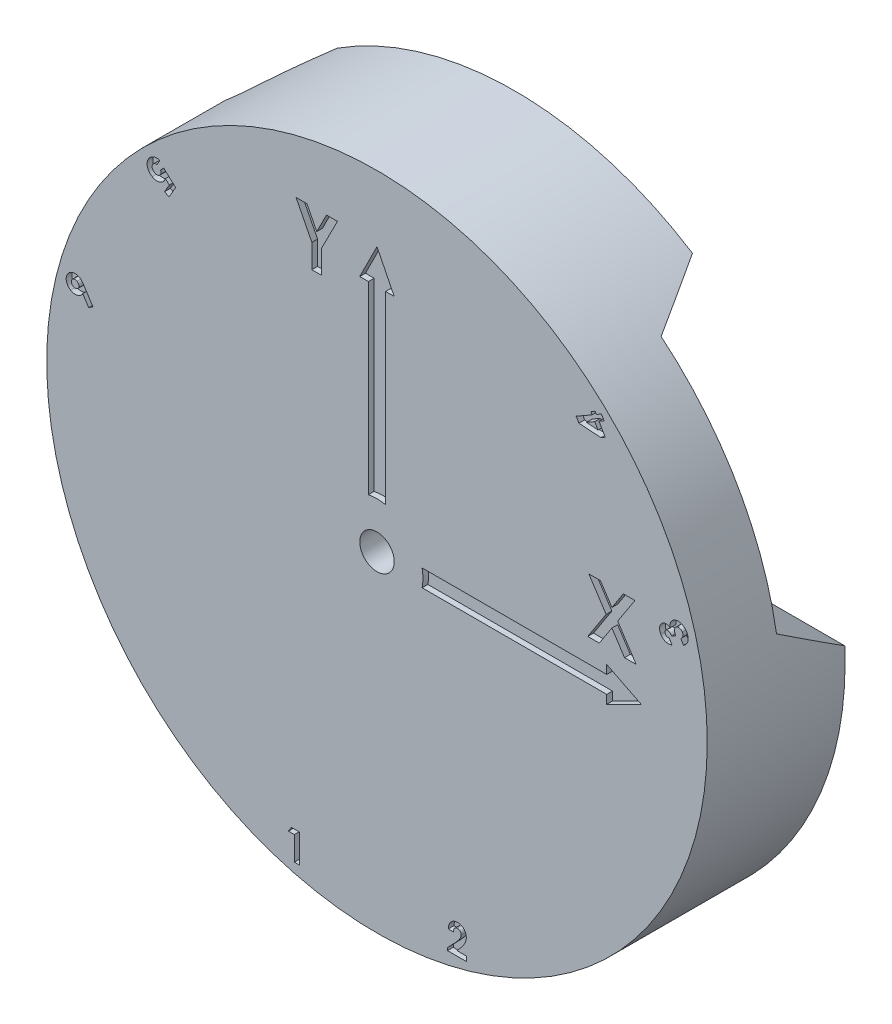
from build123d import *

# Parameters (mm, degrees)
ESQUISSE2_R                          = 57.5
BOSS_EXTRU_1_DEPTH                   = 12
ENL_V_MAT_EXTRU_12_DEPTH             = 1
ENL_V_MAT_EXTRU_13_DEPTH             = 1
ENL_V_MAT_EXTRU_16_DEPTH             = 1
ESQUISSE12_R                         = 3
ENL_V_MAT_EXTRU_14_DEPTH             = 83.197931987
ESQUISSE17_R                         = 57.5
ESQUISSE17_R_2                       = 40
BOSS_EXTRU_2_DEPTH                   = 12
EMPREINTE1_START                     = -29.216029699
EMPREINTE1_OUTLINE_R                 = 2
EMPREINTE1_DEPTH                     = 12.7
EMPREINTE1_2_OUTLINE_R               = 2
EMPREINTE1_2_DEPTH                   = 12.7
EMPREINTE1_START_2                   = 16.516029699
EMPREINTE1_3_OUTLINE_R               = 2
EMPREINTE1_3_DEPTH                   = 12.7
ENL_V_MAT_EXTRU_15_REACH             = 150.293
ENL_V_MAT_EXTRU_15_DIRECTION_2_REACH = 150.293
R_P_TITION_CIRCULAIRE1_COUNT         = 3
R_P_TITION_CIRCULAIRE1_COPY_1_REACH  = 150.293
R_P_TITION_CIRCULAIRE1_COPY_2_REACH  = 150.293
R_P_TITION_CIRCULAIRE1_COPY_3_REACH  = 150.293
R_P_TITION_CIRCULAIRE1_COPY_4_REACH  = 150.293
ENL_V_MAT_EXTRU_17_DEPTH             = 5


# Read off the part's stored shape, not the designer's step: Empreinte1
with BuildPart() as part:
    # Esquisse2 → Boss.-Extru.1 (new body)
    with BuildSketch(Plane.XY.offset(86)):
        Circle(ESQUISSE2_R)
    extrude(amount=-BOSS_EXTRU_1_DEPTH)

    # Esquisse16 → Enlèv. mat.-Extru.12 (cut)
    # profile 1 of 6: a face of its own
    with BuildSketch(Plane.XY.offset(86)):
        with BuildLine():
            Line((13.307692308, -50.666666667), (12.41025641, -50.666666667))
            add(Edge.make_bspline(
                [(12.41025641, -50.666666667), (12.414132298, -50.598780389), (12.421705551, -50.466134678), (12.451830035, -50.273462535), (12.49219581, -50.091408548), (12.546069295, -49.92060956), (12.613764854, -49.761127634), (12.693540506, -49.612419089), (12.787434338, -49.475266877), (12.893447979, -49.350332424), (13.009781611, -49.238252573), (13.134020032, -49.138875536), (13.268063636, -49.056872107), (13.409463338, -48.989390876), (13.55819506, -48.935476508), (13.715666038, -48.899430391), (13.880512802, -48.875019607), (13.99336376, -48.872883565), (14.05088141, -48.871794872)],
                knots=[0, 0, 0, 0, 1.199038563, 2.342849363, 3.436047546, 4.486744587, 5.497670872, 6.488682221, 7.459191391, 8.424610317, 9.374430501, 10.305433194, 11.225809216, 12.140057399, 13.06607119, 14.010487599, 14.985989317, 16, 16, 16, 16], degree=3))
            add(Edge.make_bspline(
                [(14.05088141, -48.871794872), (14.12148351, -48.873997843), (14.259315353, -48.87829856), (14.459595954, -48.914985102), (14.646636137, -48.976349014), (14.820299942, -49.06209058), (14.979108939, -49.171016253), (15.123036791, -49.300892291), (15.247730892, -49.454443561), (15.353981839, -49.625281047), (15.442263677, -49.8061739), (15.504127912, -49.993224611), (15.544790608, -50.181469614), (15.549127536, -50.308224271), (15.551282051, -50.37119391)],
                knots=[0, 0, 0, 0, 1.075374347, 2.099382735, 3.09057751, 4.06680945, 5.040638231, 6.016817125, 7.011024321, 8.044445721, 9.0776792, 10.070479129, 11.0414456, 12, 12, 12, 12], degree=3))
            add(Edge.make_bspline(
                [(15.551282051, -50.37119391), (15.550443197, -50.409282399), (15.54875479, -50.485945118), (15.537015075, -50.601954627), (15.519403182, -50.720123876), (15.49284874, -50.840351545), (15.459733173, -50.962671335), (15.419559204, -51.087449309), (15.371394959, -51.21397802), (15.3160442, -51.343681527), (15.250010604, -51.476980927), (15.17312366, -51.61587443), (15.083342615, -51.760238827), (14.98175191, -51.910889245), (14.867858143, -52.067588086), (14.741105323, -52.229863324), (14.602953345, -52.398286765), (14.504903, -52.510868383), (14.454527244, -52.568709936)],
                knots=[0, 0, 0, 0, 0.728284026, 1.46585585, 2.227944881, 3.01186502, 3.81876927, 4.650621989, 5.517437689, 6.406905708, 7.346299482, 8.360816762, 9.441613733, 10.596154504, 11.834900912, 13.145207542, 14.533280747, 16, 16, 16, 16], degree=3))
            Line((14.454527244, -52.568709936), (13.932692308, -53.166666667))
            Line((13.932692308, -53.166666667), (15.615384615, -53.166666667))
            Line((15.615384615, -53.166666667), (15.615384615, -54))
            Line((15.615384615, -54), (12.282051282, -54))
            Line((12.282051282, -54), (12.282051282, -53.545272436))
            Line((12.282051282, -53.545272436), (13.762419872, -51.969751603))
            add(Edge.make_bspline(
                [(13.762419872, -51.969751603), (13.805280347, -51.923793171), (13.888288376, -51.834785317), (14.006400247, -51.704067815), (14.113281058, -51.580020026), (14.206714546, -51.46132109), (14.291603982, -51.35182112), (14.364164152, -51.248219648), (14.425058925, -51.151453269), (14.491168838, -51.034769916), (14.553951524, -50.895604255), (14.611558438, -50.735279706), (14.646673838, -50.582046362), (14.651520874, -50.48219622), (14.653846154, -50.434294872)],
                knots=[0, 0, 0, 0, 1.246127091, 2.413378631, 3.493388633, 4.492180848, 5.408488754, 6.240484944, 6.999099869, 7.674939598, 8.898438119, 10.020720584, 11.050475521, 12, 12, 12, 12], degree=3))
            add(Edge.make_bspline(
                [(14.653846154, -50.434294872), (14.652107598, -50.387954013), (14.648738868, -50.298161168), (14.611719249, -50.170431325), (14.554367171, -50.054784991), (14.473549993, -49.954677809), (14.37565508, -49.872413099), (14.262528312, -49.811226919), (14.135092005, -49.775922774), (14.045756726, -49.771503956), (13.999799679, -49.769230769)],
                knots=[0, 0, 0, 0, 1.062038974, 2.057870785, 3.028805853, 4.01125022, 4.991535629, 5.949134679, 6.94496649, 8, 8, 8, 8], degree=3))
            add(Edge.make_bspline(
                [(13.999799679, -49.769230769), (13.976057684, -49.770070512), (13.929317753, -49.77172368), (13.860613707, -49.782728373), (13.795236872, -49.802122995), (13.732459566, -49.82810906), (13.672951766, -49.862553775), (13.616863568, -49.905012374), (13.563604014, -49.954405887), (13.513417373, -50.010579868), (13.467740978, -50.073270047), (13.427171371, -50.141903878), (13.393627059, -50.216438757), (13.364093428, -50.295890711), (13.341315679, -50.381113118), (13.324730652, -50.471595932), (13.312122163, -50.567191948), (13.309195788, -50.63290522), (13.307692308, -50.666666667)],
                knots=[0, 0, 0, 0, 0.903469896, 1.778625579, 2.63899355, 3.493148037, 4.358286772, 5.247621495, 6.164656832, 7.118446693, 8.109501108, 9.111810964, 10.146451449, 11.215617525, 12.33435995, 13.498009769, 14.714554818, 16, 16, 16, 16], degree=3))
        make_face()
    # profile 2 of 6: a face of its own
    with BuildSketch(Plane.XY.offset(86)):
        Polygon((-14.887219551, -49), (-13.5, -49), (-13.5, -54), (-14.397435897, -54), (-14.397435897, -49.833333333), (-15.423076923, -49.833333333), align=None)
    # profile 3 of 6: a face of its own
    with BuildSketch(Plane.XY.offset(86)):
        with BuildLine():
            Line((50.886165074, 12.41342527), (51.33788783, 11.630172065))
            add(Edge.make_bspline(
                [(51.33788783, 11.630172065), (51.296037285, 11.613554286), (51.213635119, 11.580834498), (51.088741816, 11.542842953), (50.965391179, 11.515946784), (50.844348324, 11.49700853), (50.724654303, 11.490720787), (50.607056527, 11.491970532), (50.491294494, 11.504915023), (50.415954719, 11.521656249), (50.378352574, 11.530011809)],
                knots=[0, 0, 0, 0, 1.100637514, 2.16711431, 3.187091716, 4.185678312, 5.158749046, 6.113954241, 7.058672956, 8, 8, 8, 8], degree=3))
            add(Edge.make_bspline(
                [(50.378352574, 11.530011809), (50.327224682, 11.544247327), (50.226169977, 11.572383947), (50.082606962, 11.633748016), (49.947150912, 11.706654345), (49.821662302, 11.794977525), (49.70345368, 11.89484315), (49.59659863, 12.010675414), (49.495925861, 12.137552335), (49.439505991, 12.231445763), (49.410804497, 12.279210527)],
                knots=[0, 0, 0, 0, 1.010869218, 1.99799147, 2.969307492, 3.938723657, 4.918429718, 5.913645952, 6.938645537, 8, 8, 8, 8], degree=3))
            add(Edge.make_bspline(
                [(49.410804497, 12.279210527), (49.387050874, 12.322919342), (49.34043012, 12.408705749), (49.283676364, 12.541889011), (49.241932626, 12.676271674), (49.212261177, 12.810912563), (49.197026334, 12.946534051), (49.196355859, 13.082763818), (49.208468189, 13.219911876), (49.233475925, 13.355980708), (49.269854279, 13.488262984), (49.318257976, 13.612873545), (49.376169188, 13.729121523), (49.445892103, 13.835308181), (49.52455183, 13.933755781), (49.613774595, 14.022888542), (49.713963319, 14.103132462), (49.787227489, 14.148286686), (49.824466356, 14.17123777)],
                knots=[0, 0, 0, 0, 1.10807358, 2.174793583, 3.219495373, 4.239455406, 5.242563574, 6.254351592, 7.270043138, 8.306073729, 9.333090522, 10.322281198, 11.280465358, 12.221397179, 13.147387919, 14.083750151, 15.026004476, 16, 16, 16, 16], degree=3))
            add(Edge.make_bspline(
                [(49.824466356, 14.17123777), (49.872210612, 14.19643303), (49.966529003, 14.246206061), (50.118871729, 14.29442127), (50.275927768, 14.318094963), (50.436872784, 14.320599189), (50.599635818, 14.297671583), (50.762646307, 14.252796614), (50.923280183, 14.17999996), (51.025074145, 14.116687533), (51.077471163, 14.084098347)],
                knots=[0, 0, 0, 0, 0.974570112, 1.925255358, 2.872042329, 3.837937071, 4.824805201, 5.833908719, 6.885034805, 8, 8, 8, 8], degree=3))
            add(Edge.make_bspline(
                [(51.077471163, 14.084098347), (51.069158003, 14.121714127), (51.052779495, 14.195824375), (51.039504703, 14.307130251), (51.032618862, 14.416234732), (51.036514899, 14.522991939), (51.045373241, 14.628072044), (51.066273483, 14.730403236), (51.094224849, 14.830891382), (51.130146714, 14.928800163), (51.173948034, 15.023234991), (51.226938472, 15.112154445), (51.284234916, 15.198063823), (51.351188341, 15.277143623), (51.424465337, 15.351544373), (51.505048861, 15.421067125), (51.593090157, 15.484989402), (51.655788444, 15.523158628), (51.687447125, 15.54243168)],
                knots=[0, 0, 0, 0, 1.084587699, 2.136844246, 3.154180313, 4.160940237, 5.143600227, 6.121206092, 7.097906682, 8.079846247, 9.056003269, 10.025476853, 10.99330664, 11.961501957, 12.939153063, 13.932779332, 14.956183924, 16, 16, 16, 16], degree=3))
            add(Edge.make_bspline(
                [(51.687447125, 15.54243168), (51.735342976, 15.568543369), (51.829603229, 15.619931835), (51.978148818, 15.67763032), (52.128325275, 15.720332074), (52.280761405, 15.746655016), (52.435591348, 15.755341086), (52.592399595, 15.748564296), (52.751325955, 15.723797357), (52.910558299, 15.683880869), (53.067170472, 15.629423691), (53.217130124, 15.559308638), (53.35798536, 15.472890285), (53.491634337, 15.374304885), (53.615609647, 15.259317759), (53.732112174, 15.131068646), (53.839624295, 14.987191583), (53.902831601, 14.883258557), (53.935043279, 14.830292257)],
                knots=[0, 0, 0, 0, 0.993527377, 1.955287111, 2.897436886, 3.83594311, 4.768709181, 5.719078948, 6.69169555, 7.695422729, 8.707857846, 9.709756724, 10.706540813, 11.715604557, 12.732128862, 13.783438489, 14.870396979, 16, 16, 16, 16], degree=3))
            add(Edge.make_bspline(
                [(53.935043279, 14.830292257), (53.963348173, 14.779007571), (54.01884624, 14.678452488), (54.08486462, 14.522365647), (54.135372541, 14.366892646), (54.169868233, 14.211625569), (54.188151456, 14.056898806), (54.189782858, 13.902552141), (54.177284624, 13.748377545), (54.146876364, 13.595755056), (54.10147916, 13.446347897), (54.043020979, 13.301300876), (53.966918582, 13.163951421), (53.877016144, 13.032215627), (53.771291913, 12.907440911), (53.651786543, 12.787704165), (53.516852502, 12.674934485), (53.418461992, 12.607283091), (53.368136227, 12.572680078)],
                knots=[0, 0, 0, 0, 1.080781249, 2.119113037, 3.122919527, 4.094945026, 5.050574497, 5.993659493, 6.940061788, 7.901022981, 8.860342232, 9.819483271, 10.78212307, 11.753151488, 12.759320435, 13.796572391, 14.872968757, 16, 16, 16, 16], degree=3))
            Line((53.368136227, 12.572680078), (52.902391035, 13.378970142))
            add(Edge.make_bspline(
                [(52.902391035, 13.378970142), (52.948658995, 13.419135074), (53.036520043, 13.49540671), (53.143828922, 13.623775082), (53.220123662, 13.756663692), (53.265258739, 13.893446853), (53.281548071, 14.031784601), (53.270145193, 14.170988526), (53.230452193, 14.310001319), (53.185115547, 14.396960927), (53.161806099, 14.441670463)],
                knots=[0, 0, 0, 0, 1.215812048, 2.308779549, 3.306708855, 4.242178214, 5.150446475, 6.055439415, 7.00022088, 8, 8, 8, 8], degree=3))
            add(Edge.make_bspline(
                [(53.161806099, 14.441670463), (53.147837195, 14.464628453), (53.120360173, 14.509787131), (53.073232236, 14.571986373), (53.021726499, 14.627499113), (52.966388175, 14.67678765), (52.90731817, 14.720271713), (52.843529131, 14.756254762), (52.776330157, 14.786736783), (52.682507951, 14.816513308), (52.563065642, 14.838710848), (52.419063736, 14.837742972), (52.278330439, 14.803627643), (52.192195356, 14.760288913), (52.148184304, 14.738144822)],
                knots=[0, 0, 0, 0, 0.820951101, 1.614821893, 2.380179406, 3.131809883, 3.87676154, 4.617156876, 5.366220277, 6.127759162, 7.62087363, 9.059762602, 10.497674375, 12, 12, 12, 12], degree=3))
            add(Edge.make_bspline(
                [(52.148184304, 14.738144822), (52.124748957, 14.723690348), (52.078292894, 14.695037138), (52.016269492, 14.642505978), (51.961644345, 14.583855173), (51.914386268, 14.519248559), (51.873635318, 14.448682751), (51.842106856, 14.37093491), (51.816816899, 14.287541642), (51.799816993, 14.198257904), (51.792202505, 14.104301345), (51.792746735, 14.006283009), (51.805426499, 13.905035426), (51.827796876, 13.800243706), (51.859976182, 13.692081215), (51.902681939, 13.580532468), (51.954490521, 13.465269921), (51.995770665, 13.389066068), (52.016974368, 13.349923668)],
                knots=[0, 0, 0, 0, 0.848466509, 1.681921424, 2.498142113, 3.315985831, 4.146380314, 5.005223533, 5.898042427, 6.831295342, 7.80297426, 8.802105615, 9.849699668, 10.944580868, 12.104758162, 13.327138069, 14.627074253, 16, 16, 16, 16], degree=3))
            Line((52.016974368, 13.349923668), (51.318857381, 12.947279437))
            add(Edge.make_bspline(
                [(51.318857381, 12.947279437), (51.288461854, 12.990844524), (51.231465198, 13.07253629), (51.142111927, 13.179454188), (51.059537519, 13.266626928), (50.97882569, 13.331264555), (50.89976269, 13.379222248), (50.820727804, 13.414471808), (50.739531666, 13.438114469), (50.657475594, 13.448824859), (50.57702547, 13.448778775), (50.499292474, 13.439185912), (50.425393332, 13.41720852), (50.380034373, 13.393731886), (50.35731892, 13.38197495)],
                knots=[0, 0, 0, 0, 1.631543613, 3.059414974, 4.278262358, 5.314924273, 6.226342713, 7.112821333, 7.966824641, 8.815635641, 9.646651462, 10.433090686, 11.215302614, 12, 12, 12, 12], degree=3))
            add(Edge.make_bspline(
                [(50.35731892, 13.38197495), (50.330119911, 13.364338147), (50.277089086, 13.329951076), (50.212518936, 13.261188295), (50.16586276, 13.180744706), (50.134581748, 13.091837269), (50.122408101, 12.996496179), (50.131628941, 12.898690323), (50.158066026, 12.799108163), (50.191679282, 12.737030723), (50.20908174, 12.704891616)],
                knots=[0, 0, 0, 0, 0.998984466, 1.947753752, 2.881940502, 3.854199926, 4.842042555, 5.825566253, 6.874239024, 8, 8, 8, 8], degree=3))
            add(Edge.make_bspline(
                [(50.20908174, 12.704891616), (50.226965555, 12.677245912), (50.262321793, 12.622590453), (50.329619087, 12.551237288), (50.408648084, 12.492952854), (50.497011421, 12.447308087), (50.591204334, 12.41345783), (50.68920479, 12.398651344), (50.788367158, 12.394720569), (50.853224808, 12.407125158), (50.886165074, 12.41342527)],
                knots=[0, 0, 0, 0, 1.000733368, 1.978446293, 2.966247666, 3.975356808, 4.997380958, 5.996461757, 6.982431784, 8, 8, 8, 8], degree=3))
        make_face()
    # profile 4 of 6: a face of its own
    with BuildSketch(Plane.XY.offset(86)):
        with BuildLine():
            Line((-35.058440715, 37.387856781), (-36.216293279, 35.382648448))
            Line((-36.216293279, 35.382648448), (-36.967495202, 35.816342358))
            Line((-36.967495202, 35.816342358), (-36.161205138, 37.213577935))
            Line((-36.161205138, 37.213577935), (-36.840291676, 37.838577935))
            add(Edge.make_bspline(
                [(-36.840291676, 37.838577935), (-36.847424726, 37.810695594), (-36.861449719, 37.755873369), (-36.891277163, 37.678455698), (-36.92298328, 37.605687549), (-36.947485298, 37.560313808), (-36.959482381, 37.538097166)],
                knots=[0, 0, 0, 0, 1.06420543, 2.092439393, 3.065988606, 4, 4, 4, 4], degree=3))
            add(Edge.make_bspline(
                [(-36.959482381, 37.538097166), (-36.987931968, 37.491065234), (-37.043742877, 37.398800454), (-37.142101456, 37.273102817), (-37.248541288, 37.160208198), (-37.363988365, 37.060302027), (-37.489078715, 36.97513936), (-37.62234451, 36.902026745), (-37.764967193, 36.843419702), (-37.914720687, 36.797213562), (-38.068782341, 36.766458405), (-38.224457632, 36.751210338), (-38.380302363, 36.751834645), (-38.536183949, 36.77076448), (-38.69196298, 36.803530057), (-38.847535046, 36.853410119), (-39.002893869, 36.919608622), (-39.103666493, 36.974354756), (-39.154995202, 37.002239794)],
                knots=[0, 0, 0, 0, 1.041508026, 2.043175864, 3.019433695, 3.980089598, 4.931838607, 5.883734992, 6.857217752, 7.850487817, 8.851194899, 9.830751981, 10.812046429, 11.799915004, 12.803182057, 13.826287158, 14.892815627, 16, 16, 16, 16], degree=3))
            add(Edge.make_bspline(
                [(-39.154995202, 37.002239794), (-39.205361842, 37.033034826), (-39.304700764, 37.093772354), (-39.441103819, 37.199669949), (-39.563957878, 37.314704522), (-39.671779943, 37.440604792), (-39.767771281, 37.574555523), (-39.848098277, 37.720007203), (-39.913895424, 37.874993662), (-39.967051364, 38.03702096), (-40.003558634, 38.203520296), (-40.025108629, 38.369768209), (-40.029362225, 38.534281358), (-40.015814661, 38.696624199), (-39.987247738, 38.857250353), (-39.940086035, 39.015714191), (-39.877703273, 39.172586724), (-39.822817367, 39.272400261), (-39.79501924, 39.322952935)],
                knots=[0, 0, 0, 0, 1.055785886, 2.082343212, 3.084049436, 4.062609617, 5.044011067, 6.028227449, 7.029274181, 8.053342162, 9.075316504, 10.075025092, 11.049197908, 12.014258794, 12.985789681, 13.963254867, 14.9684474, 16, 16, 16, 16], degree=3))
            add(Edge.make_bspline(
                [(-39.79501924, 39.322952935), (-39.768434192, 39.367545194), (-39.716050217, 39.455411116), (-39.625063476, 39.576198076), (-39.528677798, 39.687373702), (-39.4250803, 39.787824382), (-39.314877479, 39.878497555), (-39.196854018, 39.957722502), (-39.072482558, 40.02734647), (-38.941136874, 40.084970722), (-38.805660206, 40.132310991), (-38.666720732, 40.166120329), (-38.526058928, 40.18870387), (-38.382877645, 40.197248014), (-38.237440842, 40.194522448), (-38.089691502, 40.178137224), (-37.939681077, 40.148993729), (-37.840371037, 40.120640941), (-37.789810907, 40.10620614)],
                knots=[0, 0, 0, 0, 1.064186621, 2.096905199, 3.096744185, 4.079862237, 5.05317607, 6.019963199, 6.991758056, 7.972870521, 8.958275673, 9.931589506, 10.902104652, 11.876502018, 12.869705299, 13.882338009, 14.921868655, 16, 16, 16, 16], degree=3))
            Line((-37.789810907, 40.10620614), (-38.283600971, 39.25083755))
            add(Edge.make_bspline(
                [(-38.283600971, 39.25083755), (-38.325374043, 39.252334514), (-38.406524369, 39.255242585), (-38.524947589, 39.240186748), (-38.636481788, 39.213240252), (-38.738573637, 39.167987901), (-38.832607885, 39.112401349), (-38.91553837, 39.043012092), (-38.988981509, 38.962395946), (-39.028012483, 38.900595493), (-39.047823727, 38.869226973)],
                knots=[0, 0, 0, 0, 1.109804984, 2.155959184, 3.163698306, 4.149933146, 5.11373455, 6.059497778, 7.015044738, 8, 8, 8, 8], degree=3))
            add(Edge.make_bspline(
                [(-39.047823727, 38.869226973), (-39.059928858, 38.846729155), (-39.083820342, 38.802325978), (-39.111963497, 38.732952764), (-39.132276038, 38.662464768), (-39.144118822, 38.590850442), (-39.149126082, 38.518412954), (-39.147315571, 38.444892321), (-39.137068448, 38.370378426), (-39.119055042, 38.295975957), (-39.094133345, 38.222769986), (-39.062184658, 38.153025628), (-39.023702567, 38.086599517), (-38.977386336, 38.025017326), (-38.925133359, 37.966306143), (-38.86556178, 37.912195887), (-38.799302577, 37.861703261), (-38.750972291, 37.832464729), (-38.726309304, 37.817544281)],
                knots=[0, 0, 0, 0, 0.997812901, 1.969349307, 2.919180086, 3.858649584, 4.80029085, 5.753074062, 6.727322429, 7.733628953, 8.740358278, 9.744548131, 10.726887462, 11.734123912, 12.750445359, 13.793955032, 14.874253371, 16, 16, 16, 16], degree=3))
            add(Edge.make_bspline(
                [(-38.726309304, 37.817544281), (-38.677697284, 37.791937523), (-38.583890375, 37.742524007), (-38.433300942, 37.701246534), (-38.283612428, 37.687839547), (-38.160987313, 37.704308954), (-38.066542097, 37.728563988), (-38.00080289, 37.755480453), (-37.938265109, 37.785070645), (-37.881684619, 37.822550377), (-37.828401002, 37.864880586), (-37.781310837, 37.914093252), (-37.736680521, 37.967480215), (-37.71283057, 38.007481931), (-37.700668279, 38.02788082)],
                knots=[0, 0, 0, 0, 1.688735906, 3.25876387, 4.776101482, 6.289492917, 7.045628948, 7.775410633, 8.47475427, 9.17387086, 9.86153951, 10.567210814, 11.269348664, 12, 12, 12, 12], degree=3))
            add(Edge.make_bspline(
                [(-37.700668279, 38.02788082), (-37.688727119, 38.050652838), (-37.664609981, 38.09664468), (-37.639130036, 38.170866429), (-37.621612524, 38.24912811), (-37.614245128, 38.33185748), (-37.613990926, 38.418735261), (-37.623605863, 38.509893943), (-37.641453939, 38.605118001), (-37.660046125, 38.669045356), (-37.669618599, 38.701959345)],
                knots=[0, 0, 0, 0, 0.887533944, 1.792520965, 2.702349485, 3.652965451, 4.656779893, 5.700387855, 6.816009077, 8, 8, 8, 8], degree=3))
            Line((-37.669618599, 38.701959345), (-37.136766035, 39.278882422))
            Line((-37.136766035, 39.278882422), (-35.058440715, 37.387856781))
        make_face()
    # profile 5 of 6: a face of its own
    with BuildSketch(Plane.XY.offset(86)):
        Polygon((35.158600971, 36.963640484), (34.687847766, 37.778944972), (37.445259625, 39.371493049), (37.224907061, 39.753103625), (37.978112189, 40.187799138), (38.198464753, 39.806188561), (39.077871804, 40.314001061), (39.538608984, 39.51672542), (38.659201933, 39.00891292), (39.738929497, 37.139922536), (38.985724368, 36.705227023), align=None)
        Polygon((37.905996804, 38.574217408), (36.47070033, 37.744890484), (38.470900651, 37.595651702), align=None, mode=Mode.SUBTRACT)
    # profile 6 of 6: a face of its own
    with BuildSketch(Plane.XY.offset(86)):
        with BuildLine():
            Line((-49.450868599, 12.210638362), (-50.198064112, 11.716848298))
            Line((-50.198064112, 11.716848298), (-51.22070033, 13.306391567))
            add(Edge.make_bspline(
                [(-51.22070033, 13.306391567), (-51.247594945, 13.262446842), (-51.30058021, 13.17587104), (-51.393176739, 13.056937677), (-51.496445391, 12.951485941), (-51.607385702, 12.856483409), (-51.729002964, 12.775418175), (-51.858494982, 12.704270192), (-51.998625149, 12.647749954), (-52.145708718, 12.602827133), (-52.296970186, 12.572091222), (-52.448902114, 12.555351478), (-52.599574312, 12.556014331), (-52.749605918, 12.56970677), (-52.898794012, 12.599673738), (-53.04643756, 12.646994762), (-53.19403859, 12.706348907), (-53.288164183, 12.758172471), (-53.336084945, 12.784556631)],
                knots=[0, 0, 0, 0, 1.01748258, 2.004549365, 2.970244051, 3.929790345, 4.884881643, 5.853096672, 6.844167445, 7.864639612, 8.888007587, 9.889713619, 10.879246314, 11.859943719, 12.86260508, 13.878718062, 14.920023293, 16, 16, 16, 16], degree=3))
            add(Edge.make_bspline(
                [(-53.336084945, 12.784556631), (-53.381049091, 12.812101244), (-53.469661393, 12.866384307), (-53.591509857, 12.961383592), (-53.700727781, 13.065544273), (-53.798032594, 13.178733633), (-53.882416258, 13.301232509), (-53.953688029, 13.433433748), (-54.012891406, 13.574352526), (-54.059608626, 13.722527995), (-54.09239507, 13.874441859), (-54.110699365, 14.02601717), (-54.113883874, 14.17568483), (-54.101726861, 14.323324544), (-54.074948634, 14.469556645), (-54.030766378, 14.612996386), (-53.974277771, 14.755398697), (-53.924987894, 14.845982636), (-53.899987189, 14.891928426)],
                knots=[0, 0, 0, 0, 1.041829908, 2.05316806, 3.047563947, 4.021217687, 4.998890193, 5.982382891, 6.985155358, 8.01639353, 9.049488878, 10.053216698, 11.030287443, 12.003784562, 12.977304057, 13.962920741, 14.966757066, 16, 16, 16, 16], degree=3))
            add(Edge.make_bspline(
                [(-53.899987189, 14.891928426), (-53.871554218, 14.938647445), (-53.815771927, 15.030304907), (-53.717007705, 15.154950556), (-53.611274873, 15.267873234), (-53.495360256, 15.366624803), (-53.370033321, 15.451543771), (-53.235425295, 15.522394115), (-53.091972312, 15.581143423), (-52.941141214, 15.625337746), (-52.787557339, 15.655926941), (-52.635095787, 15.673489558), (-52.485886892, 15.676450189), (-52.339798442, 15.666037894), (-52.197785523, 15.639072795), (-52.058610425, 15.600328935), (-51.922645293, 15.546084546), (-51.836261082, 15.499433299), (-51.792615394, 15.475862721)],
                knots=[0, 0, 0, 0, 1.079944447, 2.118729597, 3.136236105, 4.133189174, 5.121435638, 6.122050302, 7.134151121, 8.180120267, 9.223109052, 10.22574492, 11.209089096, 12.168589992, 13.114633563, 14.060861198, 15.02024865, 16, 16, 16, 16], degree=3))
            add(Edge.make_bspline(
                [(-51.792615394, 15.475862721), (-51.759903187, 15.455996366), (-51.694531133, 15.416295456), (-51.601494171, 15.34712958), (-51.512981008, 15.269945957), (-51.440823238, 15.199533761), (-51.383592873, 15.134927438), (-51.335404617, 15.07841576), (-51.285040913, 15.011522068), (-51.228335341, 14.938017231), (-51.169628589, 14.854319549), (-51.106430711, 14.762230463), (-51.039647059, 14.661173497), (-50.993953854, 14.590812428), (-50.970299689, 14.554388362)],
                knots=[0, 0, 0, 0, 1.103582628, 2.205398782, 3.338835764, 4.489773427, 5.110432999, 5.828122064, 6.631432657, 7.525200043, 8.505958068, 9.579849702, 10.747152134, 12, 12, 12, 12], degree=3))
            Line((-50.970299689, 14.554388362), (-49.450868599, 12.210638362))
        make_face()
        with BuildLine():
            add(Edge.make_bspline(
                [(-51.965892638, 13.797176823), (-51.946466267, 13.834887253), (-51.90846895, 13.908647563), (-51.881561348, 14.029806438), (-51.880542451, 14.153007275), (-51.90626632, 14.275840615), (-51.954941393, 14.393638835), (-52.026276082, 14.500523829), (-52.119371711, 14.594199097), (-52.194526441, 14.641929775), (-52.233320522, 14.666567849)],
                knots=[0, 0, 0, 0, 0.99984806, 1.955668567, 2.903234403, 3.894313894, 4.903194245, 5.899638, 6.915815229, 8, 8, 8, 8], degree=3))
            add(Edge.make_bspline(
                [(-52.233320522, 14.666567849), (-52.273986959, 14.68807477), (-52.35315184, 14.729942043), (-52.482611294, 14.761462368), (-52.613208563, 14.769340253), (-52.742065825, 14.749280905), (-52.863970413, 14.709748094), (-52.970757153, 14.647288252), (-53.06274542, 14.567078567), (-53.106533605, 14.499524804), (-53.128753215, 14.465245733)],
                knots=[0, 0, 0, 0, 1.080078294, 2.102575878, 3.110847085, 4.144207722, 5.156520358, 6.111636209, 7.041780176, 8, 8, 8, 8], degree=3))
            add(Edge.make_bspline(
                [(-53.128753215, 14.465245733), (-53.148249865, 14.427542096), (-53.186534768, 14.353504755), (-53.212679404, 14.230551611), (-53.216326143, 14.104657404), (-53.192329721, 13.977900943), (-53.146318762, 13.855751995), (-53.074350711, 13.745461132), (-52.979581535, 13.649245936), (-52.902817929, 13.600102066), (-52.863328535, 13.574821054)],
                knots=[0, 0, 0, 0, 0.98015484, 1.924696457, 2.884809787, 3.88385508, 4.895860633, 5.892083164, 6.915627284, 8, 8, 8, 8], degree=3))
            add(Edge.make_bspline(
                [(-52.863328535, 13.574821054), (-52.822659341, 13.553300533), (-52.743776072, 13.511558642), (-52.615023894, 13.480268521), (-52.486151289, 13.470697692), (-52.358610603, 13.491073303), (-52.237719919, 13.532689177), (-52.130368322, 13.600073575), (-52.036280051, 13.687353693), (-51.989768083, 13.759924763), (-51.965892638, 13.797176823)],
                knots=[0, 0, 0, 0, 1.06533883, 2.066365235, 3.053587892, 4.049822867, 5.046057841, 6.004103877, 6.97546996, 8, 8, 8, 8], degree=3))
        make_face(mode=Mode.SUBTRACT)
    extrude(amount=-ENL_V_MAT_EXTRU_12_DEPTH, mode=Mode.SUBTRACT)

    # Esquisse13 → Enlèv. mat.-Extru.13 (cut)
    with BuildSketch(Plane.XY.offset(86)):
        with BuildLine():
            Line((40, 1.5), (40, 3))
            Line((40, 3), (46, 0))
            Line((46, 0), (40, -3))
            Line((40, -3), (40, -1.5))
            Line((40, -1.5), (7.858116823, -1.5))
            ThreePointArc((7.858116823, -1.5), (8, 0), (7.858116823, 1.5))
            Line((7.858116823, 1.5), (40, 1.5))
        make_face()
        with BuildLine():
            Line((1.5, 7.858116823), (1.5, 40))
            Line((1.5, 40), (3, 40))
            Line((3, 40), (0, 46))
            Line((0, 46), (-3, 40))
            Line((-3, 40), (-1.5, 40))
            Line((-1.5, 40), (-1.5, 7.858116823))
            ThreePointArc((-1.5, 7.858116823), (0, 8), (1.5, 7.858116823))
        make_face()
    extrude(amount=-ENL_V_MAT_EXTRU_13_DEPTH, mode=Mode.SUBTRACT)

    # Esquisse19 → Enlèv. mat.-Extru.16 (cut)
    with BuildSketch(Plane.XY.offset(86)):
        Polygon((44.906821232, 15.108855995), (42.891917385, 15.108855995), (40.901818227, 12.050247221), (38.907902962, 15.108855995), (36.891091063, 15.108855995), (39.894366304, 10.502816332), (36.692653563, 5.583855995), (38.707557409, 5.583855995), (40.901818227, 8.957293495), (43.101803203, 5.583855995), (45.118615102, 5.583855995), (41.90927015, 10.504724384), align=None)
        Polygon((-14.086695513, 46.380862662), (-12.184366787, 46.380862662), (-10.484291667, 43.039862061), (-8.784216546, 46.380862662), (-6.88188782, 46.380862662), (-9.629483974, 40.981072999), (-9.629483974, 36.855862662), (-11.339099359, 36.855862662), (-11.339099359, 40.981072999), align=None)
    extrude(amount=-ENL_V_MAT_EXTRU_16_DEPTH, mode=Mode.SUBTRACT)

    # Esquisse12 → Enlèv. mat.-Extru.14 (cut, through all)
    with BuildSketch(Plane.XY.offset(86)):
        Circle(ESQUISSE12_R)
    extrude(amount=-ENL_V_MAT_EXTRU_14_DEPTH, mode=Mode.SUBTRACT)

    # Esquisse17 → Boss.-Extru.2 (add)
    with BuildSketch(Plane(origin=(0, 0, 74), x_dir=(-1, 0, 0), z_dir=(0, 0, -1))):
        with Locations(Location((0, 0, 0), (0, 0, 180))):
            Circle(ESQUISSE17_R)
        Circle(ESQUISSE17_R_2, mode=Mode.SUBTRACT)
    extrude(amount=BOSS_EXTRU_2_DEPTH)

    # Empreinte1 outline → Empreinte1 (cut)
    # profile 1 of 2: a face of its own
    with BuildSketch(Plane(origin=(0, 0, 0), x_dir=(0.6797668792206172, 0.45687209604119283, 0.5737463531680093), z_dir=(0.7334282445574773, -0.42344499442653416, -0.5317681325356473)).offset(EMPREINTE1_START)):
        with BuildLine():
            Line((83.386667248, 12.132384977), (74.045229478, 20.736310848))
            Line((74.045229478, 20.736310848), (66.896395468, 12.974692602))
            Line((66.896395468, 12.974692602), (63.687416087, 9.49064571))
            Line((63.687416087, 9.49064571), (70.552214238, 9.607502832))
            ThreePointArc((70.552214238, 9.607502832), (71.941203582, 9.078885102), (72.582014467, 7.737956501))
            Line((72.582014467, 7.737956501), (72.825804935, 4))
            Line((72.825804935, 4), (75.896338753, 4))
            Line((75.896338753, 4), (76.237833237, 4.370766731))
            Line((76.237833237, 4.370766731), (83.386667248, 12.132384977))
        make_face()
        with Locations((75.667313212, 13.124389648)):
            Circle(EMPREINTE1_OUTLINE_R, mode=Mode.SUBTRACT)
    # profile 2 of 2: a face of its own
    with BuildSketch(Plane(origin=(0, 0, 0), x_dir=(0.6797668792206172, 0.45687209604119283, 0.5737463531680093), z_dir=(0.7334282445574773, -0.42344499442653416, -0.5317681325356473)).offset(EMPREINTE1_START)):
        with BuildLine():
            Line((3.785823841, 71.102648209), (4.232663228, 64.251411545))
            Line((4.232663228, 64.251411545), (7.441642611, 67.735458439))
            Line((7.441642611, 67.735458439), (14.590476621, 75.497076685))
            Line((14.590476621, 75.497076685), (5.249038852, 84.101002557))
            Line((5.249038852, 84.101002557), (-1.899795158, 76.33938431))
            Line((-1.899795158, 76.33938431), (-2, 76.230590103))
            Line((-2, 76.230590103), (-2, 72.908257027))
            Line((-2, 72.908257027), (1.756023611, 72.97219454))
            ThreePointArc((1.756023611, 72.97219454), (3.145012956, 72.44357681), (3.785823841, 71.102648209))
        make_face()
        with Locations((6.871122585, 76.489081356)):
            Circle(EMPREINTE1_OUTLINE_R, mode=Mode.SUBTRACT)
    extrude(amount=EMPREINTE1_DEPTH, mode=Mode.SUBTRACT)

    # Empreinte1 2 outline → Empreinte1 2 (cut)
    # profile 1 of 2: a face of its own
    with BuildSketch(Plane(origin=(0, 0, 0), x_dir=(1, 0, 0), z_dir=(0, 0.8468899888530688, -0.5317681325356469)).offset(EMPREINTE1_START)):
        with BuildLine():
            Line((-53.115371804, -54), (-53.115371804, -65.416269521))
            Line((-53.115371804, -65.416269521), (-40.415371804, -65.416269521))
            Line((-40.415371804, -65.416269521), (-40.415371804, -54))
            Line((-40.415371804, -54), (-44.478891755, -54))
            Line((-44.478891755, -54), (-45.385580837, -54.864087495))
            ThreePointArc((-45.385580837, -54.864087495), (-46.765371804, -55.416269521), (-48.145162772, -54.864087495))
            Line((-48.145162772, -54.864087495), (-49.051851854, -54))
            Line((-49.051851854, -54), (-53.115371804, -54))
        make_face()
        with Locations((-46.765371804, -60.916269521)):
            Circle(EMPREINTE1_2_OUTLINE_R, mode=Mode.SUBTRACT)
    # profile 2 of 2: a face of its own
    with BuildSketch(Plane(origin=(0, 0, 0), x_dir=(1, 0, 0), z_dir=(0, 0.8468899888530688, -0.5317681325356469)).offset(EMPREINTE1_START)):
        with BuildLine():
            Line((44.478891755, -54), (40.415371804, -54))
            Line((40.415371804, -54), (40.415371804, -65.416269521))
            Line((40.415371804, -65.416269521), (53.115371804, -65.416269521))
            Line((53.115371804, -65.416269521), (53.115371804, -54))
            Line((53.115371804, -54), (49.051851854, -54))
            Line((49.051851854, -54), (48.145162772, -54.864087495))
            ThreePointArc((48.145162772, -54.864087495), (46.765371804, -55.416269521), (45.385580837, -54.864087495))
            Line((45.385580837, -54.864087495), (44.478891755, -54))
        make_face()
        with Locations((46.765371804, -60.916269521)):
            Circle(EMPREINTE1_2_OUTLINE_R, mode=Mode.SUBTRACT)
    extrude(amount=EMPREINTE1_2_DEPTH, mode=Mode.SUBTRACT)

    # Empreinte1 3 outline → Empreinte1 3 (cut)
    # profile 1 of 2: a face of its own
    with BuildSketch(Plane(origin=(0, 0, 0), x_dir=(0.6797668792206174, -0.45687209604119206, -0.5737463531680094), z_dir=(0.733428244557477, 0.423444994426534, 0.531768132535648)).offset(EMPREINTE1_START_2)):
        with BuildLine():
            Line((-75.896338753, -4), (-76.237833237, -4.370766731))
            Line((-76.237833237, -4.370766731), (-83.386667248, -12.132384977))
            Line((-83.386667248, -12.132384977), (-74.045229478, -20.736310848))
            Line((-74.045229478, -20.736310848), (-66.896395468, -12.974692602))
            Line((-66.896395468, -12.974692602), (-63.687416087, -9.49064571))
            Line((-63.687416087, -9.49064571), (-70.552214238, -9.607502832))
            ThreePointArc((-70.552214238, -9.607502832), (-71.941203582, -9.078885102), (-72.582014467, -7.737956501))
            Line((-72.582014467, -7.737956501), (-72.825804935, -4))
            Line((-72.825804935, -4), (-75.896338753, -4))
        make_face()
        with Locations((-75.667313212, -13.124389648)):
            Circle(EMPREINTE1_3_OUTLINE_R, mode=Mode.SUBTRACT)
    # profile 2 of 2: a face of its own
    with BuildSketch(Plane(origin=(0, 0, 0), x_dir=(0.6797668792206174, -0.45687209604119206, -0.5737463531680094), z_dir=(0.733428244557477, 0.423444994426534, 0.531768132535648)).offset(EMPREINTE1_START_2)):
        with BuildLine():
            Line((1.899795158, -76.33938431), (2, -76.230590103))
            Line((2, -76.230590103), (2, -72.908257027))
            Line((2, -72.908257027), (-1.756023611, -72.97219454))
            ThreePointArc((-1.756023611, -72.97219454), (-3.145012956, -72.44357681), (-3.785823841, -71.102648209))
            Line((-3.785823841, -71.102648209), (-4.232663228, -64.251411545))
            Line((-4.232663228, -64.251411545), (-7.441642611, -67.735458439))
            Line((-7.441642611, -67.735458439), (-14.590476621, -75.497076685))
            Line((-14.590476621, -75.497076685), (-5.249038852, -84.101002557))
            Line((-5.249038852, -84.101002557), (1.899795158, -76.33938431))
        make_face()
        with Locations((-6.871122585, -76.489081356)):
            Circle(EMPREINTE1_3_OUTLINE_R, mode=Mode.SUBTRACT)
    extrude(amount=EMPREINTE1_3_DEPTH, mode=Mode.SUBTRACT)

    # Esquisse18 → Enlèv. mat.-Extru.15 (cut, up to next)
    with BuildSketch(Plane(origin=(-20.207685902, -35.000738686, 0), x_dir=(0.8660254037844387, -0.49999999999999983, 0), z_dir=(-0.49999999999999983, -0.8660254037844387, 0)), mode=Mode.PRIVATE) as enl_v_mat_extru_15_sk1:
        Polygon((9.539329444, 73.142390313), (28.839329444, 73.142390313), (28.839329444, 60.4), (1.538293667, 60.4), align=None)
    enl_v_mat_extru_15_tool1 = extrude(enl_v_mat_extru_15_sk1.sketch, amount=-ENL_V_MAT_EXTRU_15_REACH, mode=Mode.PRIVATE) & part.part
    enl_v_mat_extru_15 = enl_v_mat_extru_15_tool1.solids().sort_by_distance((-5.420654, -43.538036, 66.406567))[0]
    add(enl_v_mat_extru_15, mode=Mode.SUBTRACT)

    # Esquisse18 → Enlèv. mat.-Extru.15 direction 2 (cut, up to next)
    with BuildSketch(Plane(origin=(-20.207685902, -35.000738686, 0), x_dir=(0.8660254037844387, -0.49999999999999983, 0), z_dir=(-0.49999999999999983, -0.8660254037844387, 0)), mode=Mode.PRIVATE) as enl_v_mat_extru_15_direction_2_sk1:
        Polygon((9.539329444, 73.142390313), (28.839329444, 73.142390313), (28.839329444, 60.4), (1.538293667, 60.4), align=None)
    enl_v_mat_extru_15_direction_2_tool1 = extrude(enl_v_mat_extru_15_direction_2_sk1.sketch, amount=ENL_V_MAT_EXTRU_15_DIRECTION_2_REACH, mode=Mode.PRIVATE) & part.part
    enl_v_mat_extru_15_direction_2 = enl_v_mat_extru_15_direction_2_tool1.solids().sort_by_distance((-5.420654, -43.538036, 66.406567))[0]
    add(enl_v_mat_extru_15_direction_2, mode=Mode.SUBTRACT)

    # Symétrie1: Enlèv. mat.-Extru.15, Enlèv. mat.-Extru.15 direction 2 across plane
    add(enl_v_mat_extru_15.mirror(Plane(origin=(0, 0, 0), x_dir=(0, 0, 1), z_dir=(1, 0, 0))), mode=Mode.SUBTRACT)
    add(enl_v_mat_extru_15_direction_2.mirror(Plane(origin=(0, 0, 0), x_dir=(0, 0, 1), z_dir=(1, 0, 0))), mode=Mode.SUBTRACT)

    # Répétition circulaire1: Enlèv. mat.-Extru.15, Enlèv. mat.-Extru.15 direction 2 ×3 about axis
    r_p_tition_circulaire1_axis = Axis((0, 0, 0), (0, 0, 1))
    add([enl_v_mat_extru_15.rotate(r_p_tition_circulaire1_axis, i * 360 / R_P_TITION_CIRCULAIRE1_COUNT) for i in range(1, R_P_TITION_CIRCULAIRE1_COUNT)], mode=Mode.SUBTRACT)
    add([enl_v_mat_extru_15_direction_2.rotate(r_p_tition_circulaire1_axis, i * 360 / R_P_TITION_CIRCULAIRE1_COUNT) for i in range(1, R_P_TITION_CIRCULAIRE1_COUNT)], mode=Mode.SUBTRACT)

    # Répétition circulaire1 copy 1 sketch → Répétition circulaire1 copy 1 (cut, up to next)
    with BuildSketch(Plane(origin=(20.207685902, 35.000738686, 0), x_dir=(0.8660254037844384, -0.5000000000000003, 0), z_dir=(0.5000000000000003, 0.8660254037844384, 0)), mode=Mode.PRIVATE) as r_p_tition_circulaire1_copy_1_sk1:
        Polygon((9.539329444, -73.142390313), (28.839329444, -73.142390313), (28.839329444, -60.4), (1.538293667, -60.4), align=None)
    r_p_tition_circulaire1_copy_1_tool1 = extrude(r_p_tition_circulaire1_copy_1_sk1.sketch, amount=-R_P_TITION_CIRCULAIRE1_COPY_1_REACH, mode=Mode.PRIVATE) & part.part
    add(r_p_tition_circulaire1_copy_1_tool1.solids().sort_by_distance((34.994718207, 26.463442069, 66.406567))[0], mode=Mode.SUBTRACT)

    # Répétition circulaire1 copy 2 sketch → Répétition circulaire1 copy 2 (cut, up to next)
    with BuildSketch(Plane(origin=(-40.415371804, 0, 0), x_dir=(0, 1, 0), z_dir=(-1, 0, 0)), mode=Mode.PRIVATE) as r_p_tition_circulaire1_copy_2_sk1:
        Polygon((9.539329444, -73.142390313), (28.839329444, -73.142390313), (28.839329444, -60.4), (1.538293667, -60.4), align=None)
    r_p_tition_circulaire1_copy_2_tool1 = extrude(r_p_tition_circulaire1_copy_2_sk1.sketch, amount=-R_P_TITION_CIRCULAIRE1_COPY_2_REACH, mode=Mode.PRIVATE) & part.part
    add(r_p_tition_circulaire1_copy_2_tool1.solids().sort_by_distance((-40.415372207, 17.074593931, 66.406567))[0], mode=Mode.SUBTRACT)

    # Répétition circulaire1 copy 3 sketch → Répétition circulaire1 copy 3 (cut, up to next)
    with BuildSketch(Plane(origin=(20.207685902, 35.000738686, 0), x_dir=(0.8660254037844384, -0.5000000000000003, 0), z_dir=(0.5000000000000003, 0.8660254037844384, 0)), mode=Mode.PRIVATE) as r_p_tition_circulaire1_copy_3_sk1:
        Polygon((9.539329444, -73.142390313), (28.839329444, -73.142390313), (28.839329444, -60.4), (1.538293667, -60.4), align=None)
    r_p_tition_circulaire1_copy_3_tool1 = extrude(r_p_tition_circulaire1_copy_3_sk1.sketch, amount=R_P_TITION_CIRCULAIRE1_COPY_3_REACH, mode=Mode.PRIVATE) & part.part
    add(r_p_tition_circulaire1_copy_3_tool1.solids().sort_by_distance((34.994718207, 26.463442069, 66.406567))[0], mode=Mode.SUBTRACT)

    # Répétition circulaire1 copy 4 sketch → Répétition circulaire1 copy 4 (cut, up to next)
    with BuildSketch(Plane(origin=(-40.415371804, 0, 0), x_dir=(0, 1, 0), z_dir=(-1, 0, 0)), mode=Mode.PRIVATE) as r_p_tition_circulaire1_copy_4_sk1:
        Polygon((9.539329444, -73.142390313), (28.839329444, -73.142390313), (28.839329444, -60.4), (1.538293667, -60.4), align=None)
    r_p_tition_circulaire1_copy_4_tool1 = extrude(r_p_tition_circulaire1_copy_4_sk1.sketch, amount=R_P_TITION_CIRCULAIRE1_COPY_4_REACH, mode=Mode.PRIVATE) & part.part
    add(r_p_tition_circulaire1_copy_4_tool1.solids().sort_by_distance((-40.415372207, 17.074593931, 66.406567))[0], mode=Mode.SUBTRACT)

    # Esquisse20 → Enlèv. mat.-Extru.17 (cut)
    with BuildSketch(Plane(origin=(0, 0, 74), x_dir=(-1, 0, 0), z_dir=(0, 0, -1))):
        Polygon((0, -6.0044428), (2.6, -4.5033321), (5.2, -3.0022214), (5.2, 0), (5.2, 3.0022214), (2.6, 4.5033321), (0, 6.0044428), (-2.6, 4.5033321), (-5.2, 3.0022214), (-5.2, 0), (-5.2, -3.0022214), (-2.6, -4.5033321), align=None)
    extrude(amount=-ENL_V_MAT_EXTRU_17_DEPTH, mode=Mode.SUBTRACT)


solid = part.part
